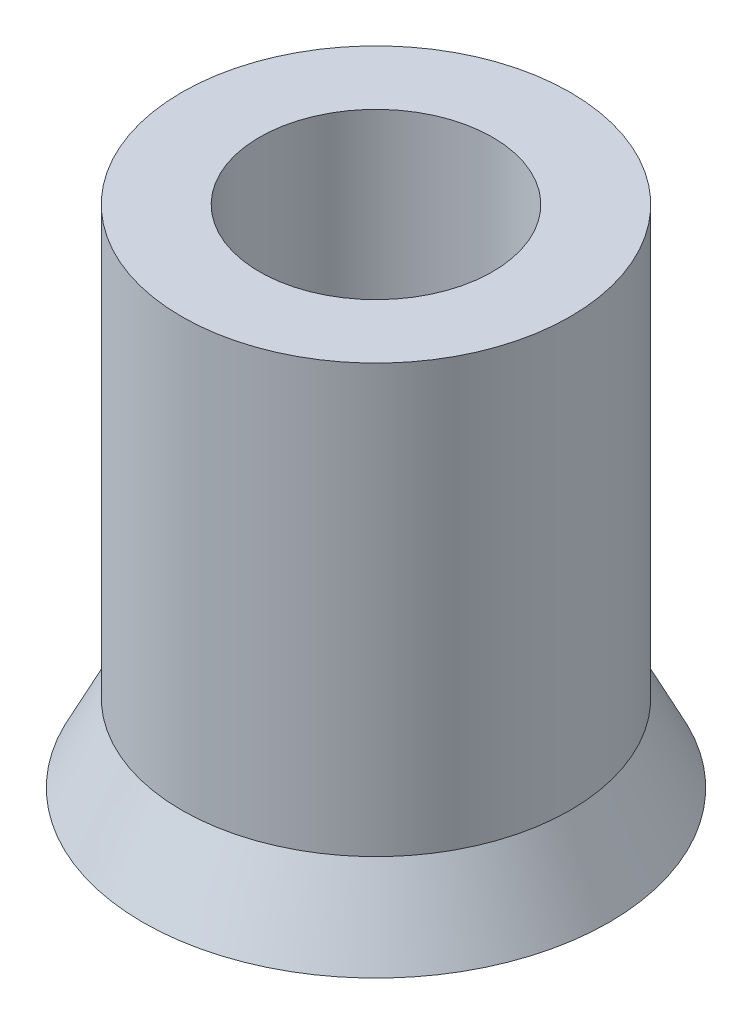
from build123d import *

# Parameters (mm, degrees)
SKETCH_1_R       = 5
SKETCH_1_R_2     = 3
EXTRUDE_1_DEPTH  = 13
SKETCH_1_3_R     = 6
SKETCH_1_3_R_2   = 5
EXTRUDE_2_DEPTH  = 2
CHAMFER_1_SIZE   = 1
CHAMFER_1_SIZE_2 = 2


with BuildPart() as part:
    # 草图1 → 凸台-拉伸1 (new body)
    with BuildSketch(Plane(origin=(0, 0, 0), x_dir=(1, 0, 0), z_dir=(0, 1, 0))):
        with Locations(Location((0, 0, 0), (0, 0, 90))):
            Circle(SKETCH_1_R)
        with Locations(Location((0, 0, 0), (0, 0, 90))):
            Circle(SKETCH_1_R_2, mode=Mode.SUBTRACT)
    extrude(amount=EXTRUDE_1_DEPTH)

    # 草图1<3> → 凸台-拉伸2 (add)
    with BuildSketch(Plane(origin=(0, 0, 0), x_dir=(1, 0, 0), z_dir=(0, 1, 0))):
        with Locations(Location((0, 0, 0), (0, 0, 270))):
            Circle(SKETCH_1_3_R)
        with Locations(Location((0, 0, 0), (0, 0, 90))):
            Circle(SKETCH_1_3_R_2, mode=Mode.SUBTRACT)
    extrude(amount=EXTRUDE_2_DEPTH)

    # 倒角1
    # the kernel refuses this chamfer: 2, 1 mm, written as the material it takes off along each edge
    with BuildSketch(Plane(origin=(0, 2, 0), x_dir=(0, 0, 1), z_dir=(-1, 0, 0))) as chamfer_1_piece_1:
        Polygon((6 - CHAMFER_1_SIZE, 0), (6, -CHAMFER_1_SIZE_2), (6, 0), align=None)
    revolve(axis=Axis((0, 2, 0), (0, 1, 0)), mode=Mode.SUBTRACT)


solid = part.part
